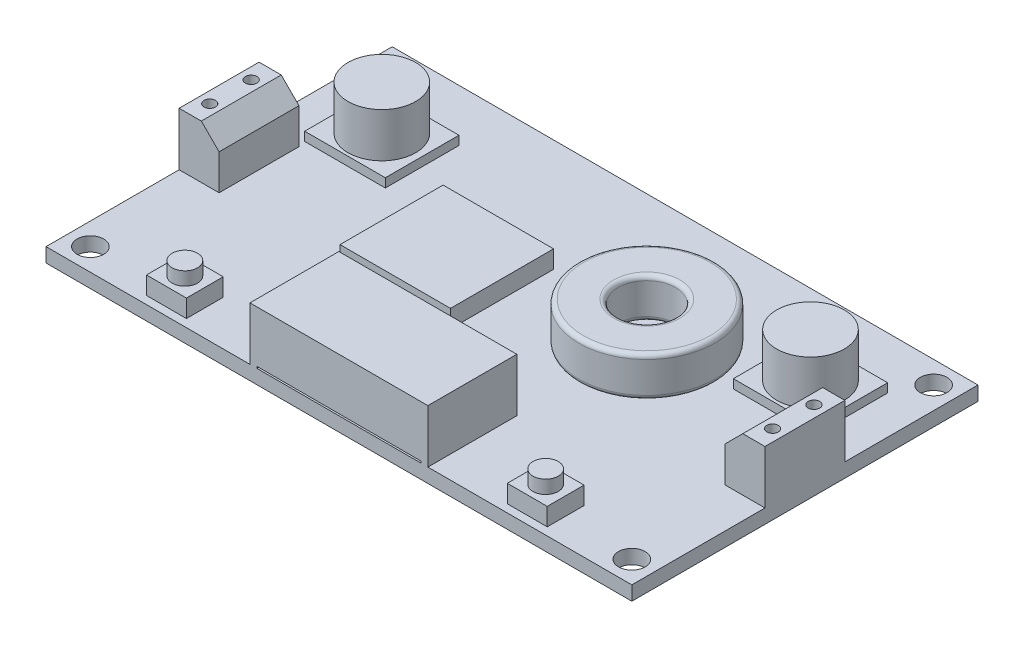
from build123d import *

# Parameters (mm, degrees)
SKETCH_1_W          = 66
SKETCH_1_H          = 39
EXTRUDE_1_DEPTH     = 1.6
SKETCH_2_R          = 1.5
CUT_EXTRUDE_1_DEPTH = 1.6
SKETCH_3_W          = 4.5
SKETCH_3_H          = 9
EXTRUDE_2_DEPTH     = 6
CHAMFER_1_SIZE      = 2
SKETCH_6_R          = 0.65
CUT_EXTRUDE_2_DEPTH = 1
SKETCH_7_W          = 20.048070128
SKETCH_7_H          = 10.01913925
EXTRUDE_3_DEPTH     = 6
SKETCH_8_W          = 18.487369842
SKETCH_8_H          = 0.2
CUT_EXTRUDE_3_DEPTH = 45.571855355
SKETCH_9_R          = 7.645962027
SKETCH_9_R_2        = 3.237215686
EXTRUDE_4_DEPTH     = 4.5
FILLET_1_R          = 0.5
SKETCH_10_W         = 9.085824886
SKETCH_10_H         = 8.295753157
SKETCH_10_R         = 3.812502592
EXTRUDE_5_DEPTH     = 1
SKETCH_11_R         = 3.812502592
EXTRUDE_6_DEPTH     = 5
SKETCH_12_W         = 12.443629735
SKETCH_12_H         = 11.614054419
EXTRUDE_7_DEPTH     = 2
SKETCH_13_W         = 4.503408857
SKETCH_13_H         = 4.147876578
EXTRUDE_8_DEPTH     = 2
SKETCH_14_R         = 1.427058518
EXTRUDE_9_DEPTH     = 1.5


with BuildPart() as part:
    # 草图1 → 凸台-拉伸1 (new body)
    with BuildSketch(Plane(origin=(0, 0, 0), x_dir=(1, 0, 0), z_dir=(0, 1, 0))):
        Rectangle(SKETCH_1_W, SKETCH_1_H)
    extrude(amount=EXTRUDE_1_DEPTH)

    # 草图2 → 切除-拉伸1 (cut)
    with BuildSketch(Plane(origin=(0, 1.6, 0), x_dir=(1, 0, 0), z_dir=(0, 1, 0))):
        with Locations(Location((-30.5, -17, 0), (0, 0, 270))):
            Circle(SKETCH_2_R)
        with Locations(Location((30.5, -17, 0), (0, 0, 90))):
            Circle(SKETCH_2_R)
        with Locations(Location((30.5, 17, 0), (0, 0, 270))):
            Circle(SKETCH_2_R)
        with Locations(Location((-30.5, 17, 0), (0, 0, 90))):
            Circle(SKETCH_2_R)
    extrude(amount=-CUT_EXTRUDE_1_DEPTH, mode=Mode.SUBTRACT)

    # 草图3 → 凸台-拉伸2 (add)
    with BuildSketch(Plane(origin=(0, 1.6, 0), x_dir=(1, 0, 0), z_dir=(0, 1, 0))):
        with Locations((-30.75, 0)):
            Rectangle(SKETCH_3_W, SKETCH_3_H)
        with Locations((30.75, 0)):
            Rectangle(SKETCH_3_W, SKETCH_3_H)
    extrude(amount=EXTRUDE_2_DEPTH)

    # 倒角1
    chamfer_1_edges = [part.edges().sort_by_distance(p)[0] for p in [
        (-28.5, 7.6, 0),
        (28.5, 7.6, 0),
    ]]
    chamfer(chamfer_1_edges, length=CHAMFER_1_SIZE)

    # 草图6 → 切除-拉伸2 (cut)
    with BuildSketch(Plane(origin=(0, 7.6, 0), x_dir=(1, 0, 0), z_dir=(0, 1, 0))):
        with Locations(Location((-31.719459614, 2.331808923, 0), (0, 0, 270))):
            Circle(SKETCH_6_R)
        with Locations(Location((-31.719459614, -2.331808923, 0), (0, 0, 270))):
            Circle(SKETCH_6_R)
        with Locations(Location((31.687681101, -2.331808923, 0), (0, 0, 270))):
            Circle(SKETCH_6_R)
        with Locations(Location((31.687681101, 2.331808923, 0), (0, 0, 270))):
            Circle(SKETCH_6_R)
    extrude(amount=-CUT_EXTRUDE_2_DEPTH, mode=Mode.SUBTRACT)

    # 草图7 → 凸台-拉伸3 (add)
    with BuildSketch(Plane(origin=(0, 1.6, 0), x_dir=(1, 0, 0), z_dir=(0, 1, 0))):
        with Locations((0, -14.490430375)):
            Rectangle(SKETCH_7_W, SKETCH_7_H)
    extrude(amount=EXTRUDE_3_DEPTH)

    # 草图8 → 切除-拉伸3 (cut, through all)
    with BuildSketch(Plane(origin=(0, 0, 9.48086075), x_dir=(-1, 0, 0), z_dir=(0, 0, -1))):
        with Locations((0, 1.7)):
            Rectangle(SKETCH_8_W, SKETCH_8_H)
    extrude(amount=-CUT_EXTRUDE_3_DEPTH, mode=Mode.SUBTRACT)


with BuildPart() as body_2:
    # 草图9 → 凸台-拉伸4 (new body)
    with BuildSketch(Plane(origin=(0, 1.6, 0), x_dir=(1, 0, 0), z_dir=(0, 1, 0))):
        with Locations(Location((10.458848846, 4.732200461, 0), (0, 0, 270))):
            Circle(SKETCH_9_R)
        with Locations(Location((10.458848846, 4.732200461, 0), (0, 0, 270))):
            Circle(SKETCH_9_R_2, mode=Mode.SUBTRACT)
    extrude(amount=EXTRUDE_4_DEPTH)

    # 圆角1
    fillet_1_edges = [body_2.edges().sort_by_distance(p)[0] for p in [
        (10.458848846, 1.6, -12.378162489),
        (10.458848846, 6.1, -12.378162489),
        (10.458848846, 1.6, -7.969416147),
        (10.458848846, 6.1, -7.969416147),
    ]]
    fillet(fillet_1_edges, radius=FILLET_1_R)


with BuildPart() as part_1:
    add(part.part)

    # 相交1: read off the stored shape, not the designer's step
    # 相交1: union body 2
    add(body_2.part)

    # 草图10 → 凸台-拉伸5 (add)
    # profile 1 of 3: a face of its own
    with BuildSketch(Plane(origin=(0, 1.6, 0), x_dir=(1, 0, 0), z_dir=(0, 1, 0))):
        with Locations((24.146567223, 9.480860751)):
            Rectangle(SKETCH_10_W, SKETCH_10_H)
        with Locations((24.146567223, 9.48086075)):
            Circle(SKETCH_10_R, mode=Mode.SUBTRACT)
    # profile 2 of 3: a face of its own
    with BuildSketch(Plane(origin=(0, 1.6, 0), x_dir=(1, 0, 0), z_dir=(0, 1, 0))):
        with Locations((24.146567223, 9.48086075)):
            Circle(SKETCH_10_R)
    # profile 3 of 3: a face of its own
    with BuildSketch(Plane(origin=(0, 1.6, 0), x_dir=(1, 0, 0), z_dir=(0, 1, 0))):
        with Locations((-24.146567223, 9.480860751)):
            Rectangle(SKETCH_10_W, SKETCH_10_H)
    extrude(amount=EXTRUDE_5_DEPTH)

    # 草图11 → 凸台-拉伸6 (add)
    with BuildSketch(Plane(origin=(0, 2.6, 0), x_dir=(1, 0, 0), z_dir=(0, 1, 0))):
        with Locations(Location((-24.146567223, 9.48086075, 0), (0, 0, 270))):
            Circle(SKETCH_11_R)
        with Locations(Location((24.146567223, 9.48086075, 0), (0, 0, 270))):
            Circle(SKETCH_11_R)
    extrude(amount=EXTRUDE_6_DEPTH)

    # 草图12 → 凸台-拉伸7 (add)
    with BuildSketch(Plane(origin=(0, 1.6, 0), x_dir=(1, 0, 0), z_dir=(0, 1, 0))):
        with Locations((-8.414263916, 1.066596835)):
            Rectangle(SKETCH_12_W, SKETCH_12_H)
    extrude(amount=EXTRUDE_7_DEPTH)

    # 草图13 → 凸台-拉伸8 (add)
    with BuildSketch(Plane(origin=(0, 1.6, 0), x_dir=(1, 0, 0), z_dir=(0, 1, 0))):
        with Locations((-20.324595233, -16.532250933)):
            Rectangle(SKETCH_13_W, SKETCH_13_H)
        with Locations((20.324595233, -16.532250933)):
            Rectangle(SKETCH_13_W, SKETCH_13_H)
    extrude(amount=EXTRUDE_8_DEPTH)

    # 草图14 → 凸台-拉伸9 (add)
    with BuildSketch(Plane(origin=(0, 3.6, 0), x_dir=(1, 0, 0), z_dir=(0, 1, 0))):
        with Locations(Location((-20.324595233, -16.532250933, 0), (0, 0, 270))):
            Circle(SKETCH_14_R)
        with Locations(Location((20.324595233, -16.532250933, 0), (0, 0, 270))):
            Circle(SKETCH_14_R)
    extrude(amount=EXTRUDE_9_DEPTH)


solid = part_1.part
